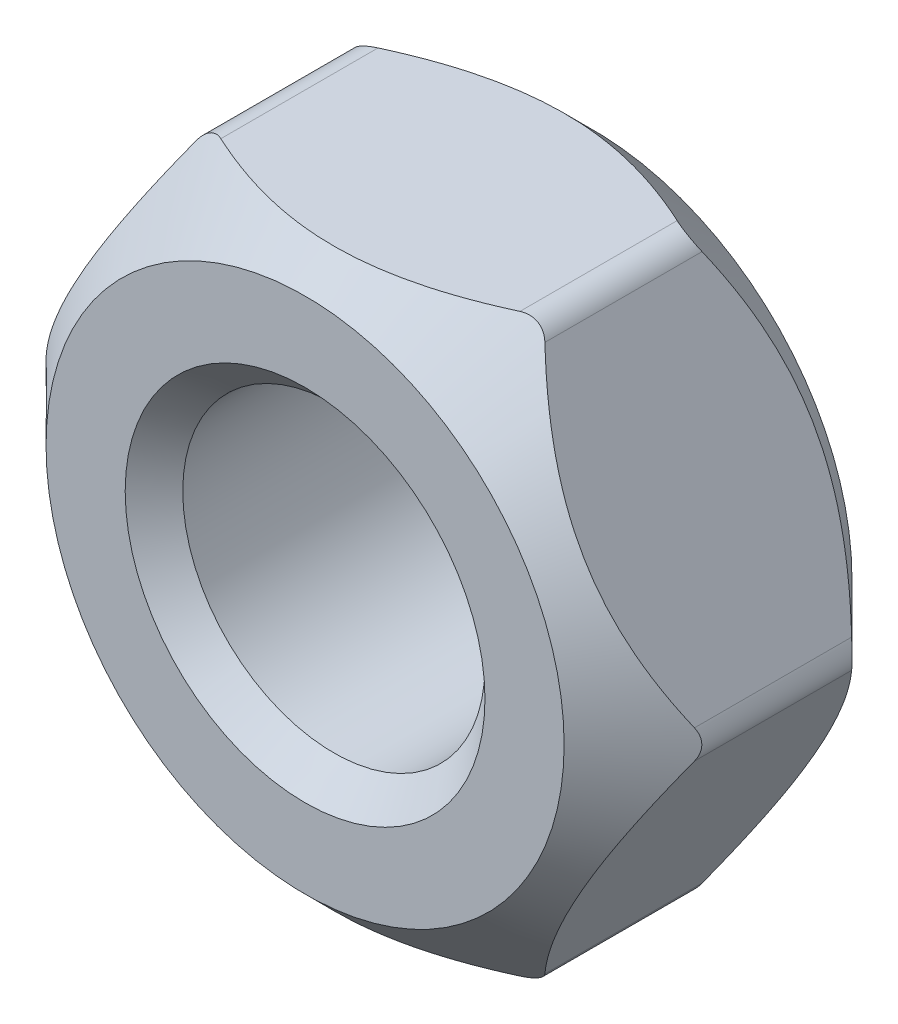
from build123d import *

# Parameters (mm, degrees)
SKETCH1_R           = 1.575
BOSS_EXTRUDE1_DEPTH = 1.5
FILLET1_R           = 0.3
CHAMFER1_SIZE       = 0.3


with BuildPart() as part:
    # Sketch1 → Boss-Extrude1 (new, symmetric)
    with BuildSketch(Plane.XY):
        Polygon((1.732050808, 3), (-1.732050808, 3), (-3.464101615, 0), (-1.732050808, -3), (1.732050808, -3), (3.464101615, 0), align=None)
        Circle(SKETCH1_R, mode=Mode.SUBTRACT)
    extrude(amount=BOSS_EXTRUDE1_DEPTH, both=True)

    # Sketch2 → Cut-Revolve1 (revolve, cut)
    with BuildSketch(Plane(origin=(0, 0, 0), x_dir=(0, 0, -1), z_dir=(1, 0, 0))):
        Polygon((1.5, 3.464101615), (0.735898385, 3.464101615), (1.5, 2.7), align=None)
    cut_revolve1 = revolve(axis=Axis((0, 0, 0), (0, 0, -1)), mode=Mode.SUBTRACT)

    # Mirror1: Cut-Revolve1 across plane
    add(cut_revolve1.mirror(Plane.XY), mode=Mode.SUBTRACT)

    # Fillet1
    fillet1_edges = [part.edges().sort_by_distance(p)[0] for p in [
        (3.464101615, 0, 0),
        (1.732050808, -3, 0),
        (-1.732050808, -3, 0),
        (-3.464101615, 0, 0),
        (-1.732050808, 3, 0),
        (1.732050808, 3, 0),
    ]]
    fillet(fillet1_edges, radius=FILLET1_R)

    # Chamfer1
    chamfer1_edges = [part.edges().sort_by_distance(p)[0] for p in [
        (-1.575, 0, -1.5),
        (-1.575, 0, 1.5),
    ]]
    chamfer(chamfer1_edges, length=CHAMFER1_SIZE)


solid = part.part
